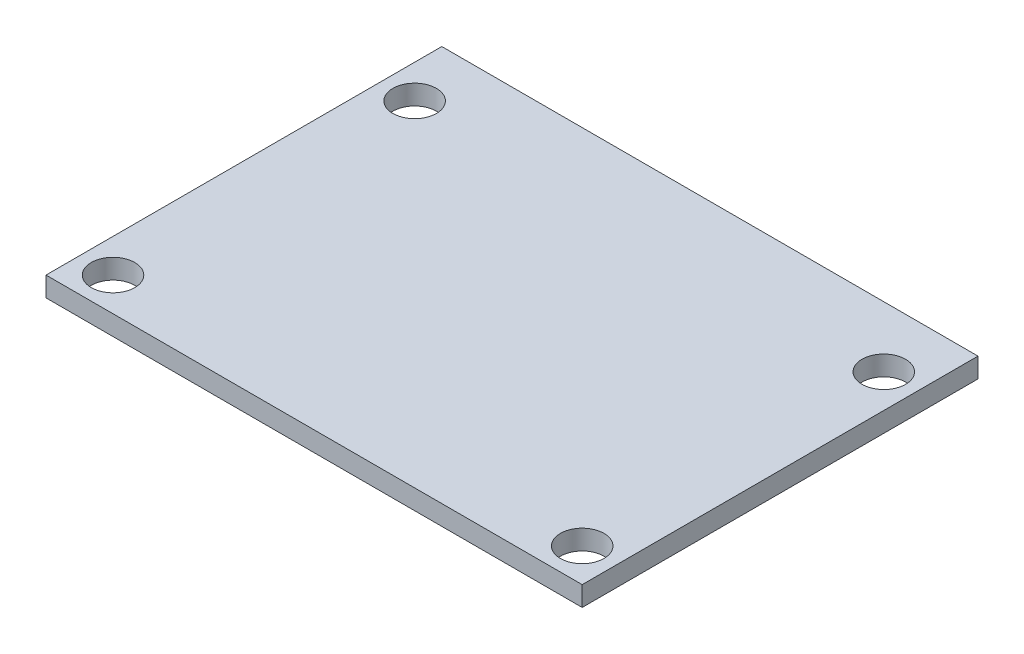
from build123d import *

# Parameters (mm, degrees)
SZKIC2_W                    = 40.64
SZKIC2_H                    = 30
SZKIC2_R                    = 1.65
DODANIE_WYCI_GNI_CIE1_DEPTH = 1.5


with BuildPart() as part:
    # Szkic2 → Dodanie-wyciągnięcie1 (new body)
    with BuildSketch(Plane(origin=(0, 0, 0), x_dir=(1, 0, 0), z_dir=(0, 1, 0))):
        Rectangle(SZKIC2_W, SZKIC2_H)
        with Locations((-17.78, -12.46)):
            Circle(SZKIC2_R, mode=Mode.SUBTRACT)
        with Locations((-17.78, 10.4)):
            Circle(SZKIC2_R, mode=Mode.SUBTRACT)
        with Locations((17.78, -12.46)):
            Circle(SZKIC2_R, mode=Mode.SUBTRACT)
        with Locations((17.78, 10.4)):
            Circle(SZKIC2_R, mode=Mode.SUBTRACT)
    extrude(amount=DODANIE_WYCI_GNI_CIE1_DEPTH)


solid = part.part
